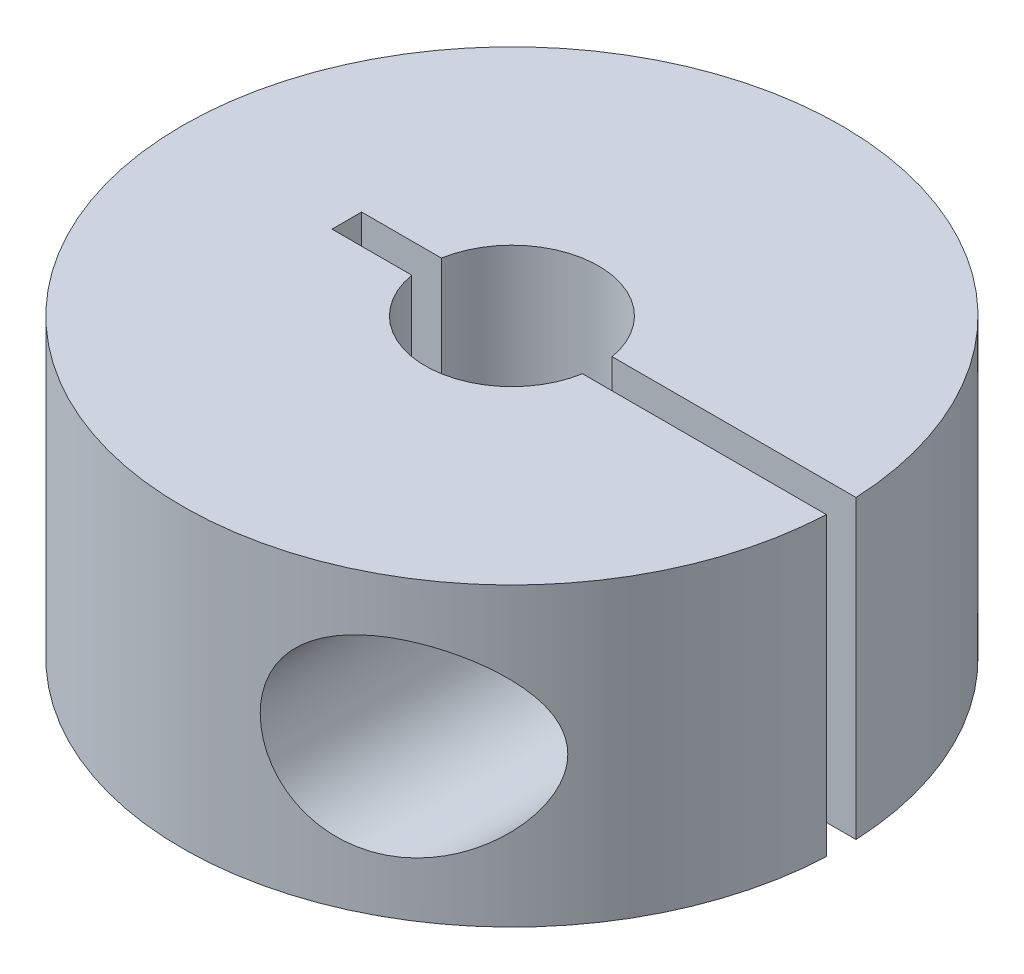
from build123d import *

# Parameters (mm, degrees)
SKETCH1_R               = 11.125
BOSS_EXTRUDE1_DEPTH     = 10
CUT_EXTRUDE1_DEPTH      = 21.573800087
SKETCH3_W               = 17
SKETCH3_H               = 1
CUT_EXTRUDE2_DEPTH      = 19.642190054
SKETCH8_R               = 3.19
CUT_EXTRUDE3_DEPTH      = 22.703484743
CUT_EXTRUDE4_DEPTH      = 19.642190227
CUT_EXTRUDE4_DEPTH_BACK = 19.642190227
SKETCH9_R               = 2.925


with BuildPart() as part:
    # Sketch1 → Boss-Extrude1 (new body)
    with BuildSketch(Plane(origin=(0, 0, 0), x_dir=(1, 0, 0), z_dir=(0, 1, 0))):
        Circle(SKETCH1_R)
    extrude(amount=BOSS_EXTRUDE1_DEPTH)

    # Sketch2 → Cut-Extrude1 (cut, through all)
    with BuildSketch(Plane.XY.offset(-3)):
        Polygon((4.358109394, 2.895375742), (6.78296277, 2.90465501), (7.987353376, 5.009279269), (6.766890606, 7.104624258), (4.34203723, 7.09534499), (3.137646624, 4.990720731), align=None)
    extrude(amount=-CUT_EXTRUDE1_DEPTH, mode=Mode.SUBTRACT)

    # Sketch3 → Cut-Extrude2 (cut, through all)
    with BuildSketch(Plane(origin=(0, 0, 0), x_dir=(1, 0, 0), z_dir=(0, 1, 0))):
        with Locations((2.926474536, 0)):
            Rectangle(SKETCH3_W, SKETCH3_H)
    extrude(amount=CUT_EXTRUDE2_DEPTH, mode=Mode.SUBTRACT)

    # Sketch7 → CBORE for M2 Hex Head Machine Screw1 (revolve, cut)
    with BuildSketch(Plane(origin=(5.5625, 5, 4.6), x_dir=(0, -1, 0), z_dir=(1, 0, 0))):
        Polygon((0, 0), (0, 15.725), (1.2, 15.725), (1.2, 1.6), (3.19, 1.6), (3.19, 0), align=None)
    revolve(axis=Axis((5.5625, 5, 10.95), (0, 0, -1)), mode=Mode.SUBTRACT)

    # Sketch8 → Cut-Extrude3 (cut, through all)
    with BuildSketch(Plane.XY.offset(4.6)):
        with Locations((5.5625, 5)):
            Circle(SKETCH8_R)
    extrude(amount=CUT_EXTRUDE3_DEPTH, mode=Mode.SUBTRACT)

    # Sketch9 → Cut-Extrude4 (cut, two sides: drawn at the far end of the back side and taken through both)
    with BuildSketch(Plane(origin=(0, 0, 0), x_dir=(1, 0, 0), z_dir=(0, 1, 0)).offset(-CUT_EXTRUDE4_DEPTH_BACK)):
        Circle(SKETCH9_R)
    extrude(amount=CUT_EXTRUDE4_DEPTH + CUT_EXTRUDE4_DEPTH_BACK, mode=Mode.SUBTRACT)


solid = part.part
